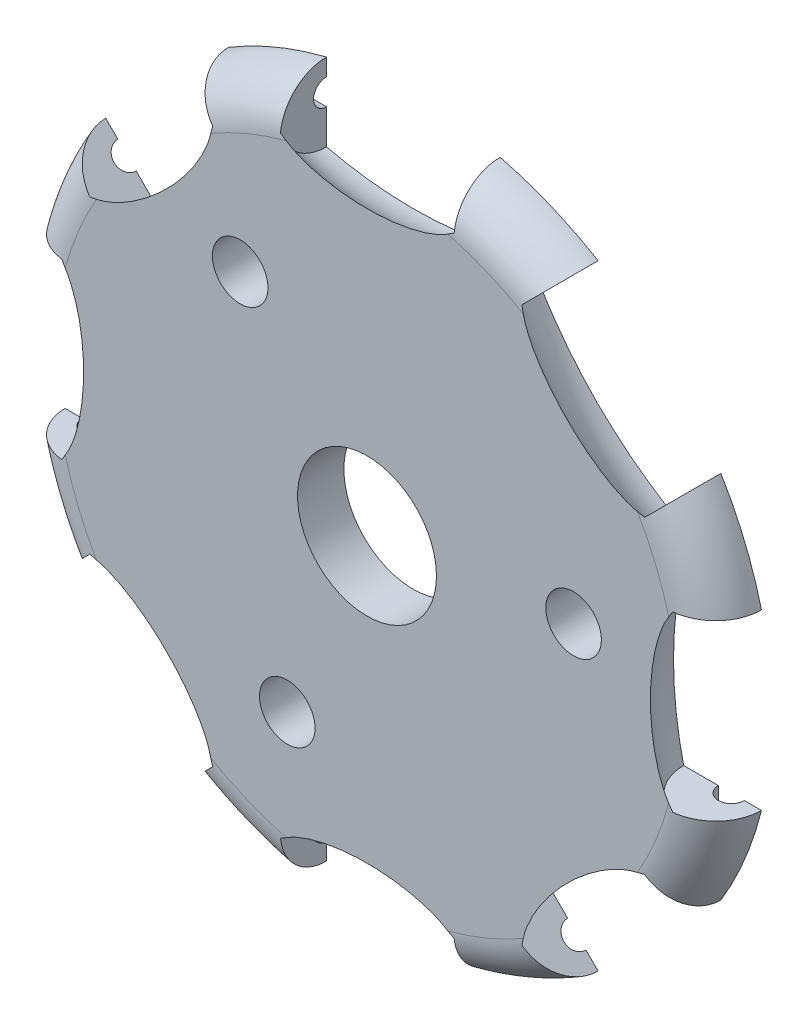
from build123d import *

# Parameters (mm, degrees)
SKETCH1_R           = 24.60625
BOSS_EXTRUDE1_DEPTH = 3.175
FILLET1_R           = 3.18516
SKETCH2_R           = 1.905
SKETCH2_R_2         = 4.7625
CUT_EXTRUDE1_DEPTH  = 35.943012295
SKETCH6_R           = 0.889
CUT_EXTRUDE2_DEPTH  = 7.9375
CIRPATTERN1_COUNT   = 8


with BuildPart() as part:
    # Sketch1 → Boss-Extrude1 (new body)
    with BuildSketch(Plane.XY):
        Circle(SKETCH1_R)
    extrude(amount=BOSS_EXTRUDE1_DEPTH)

    # Fillet1
    # the kernel refuses this fillet: 3.18516 mm, written as the material it takes off along each edge
    with BuildSketch(Plane(origin=(0, 0, 3.175), x_dir=(1, 0, 0), z_dir=(0, -1, 0))) as fillet1_piece_1:
        with BuildLine():
            CenterArc((24.60625 - FILLET1_R, -FILLET1_R), FILLET1_R, 0, 90)
            Line((24.60625 - FILLET1_R, 0), (24.60625, 0))
            Line((24.60625, 0), (24.60625, -FILLET1_R))
        make_face()
    revolve(axis=Axis((0, 0, 3.175), (0, 0, 1)), mode=Mode.SUBTRACT)

    # Sketch2 → Cut-Extrude1 (cut, through all)
    with BuildSketch(Plane.XY.offset(3.175)):
        with Locations((-5.46758954, -13.199928821)):
            Circle(SKETCH2_R)
        with Locations((-8.697678917, 11.335035849)):
            Circle(SKETCH2_R)
        with Locations((14.165268457, 1.864892971)):
            Circle(SKETCH2_R)
        Circle(SKETCH2_R_2)
    extrude(amount=-CUT_EXTRUDE1_DEPTH, mode=Mode.SUBTRACT)

    # Sketch5 → Cut-Revolve1 (revolve, cut)
    with BuildSketch(Plane.XY):
        with BuildLine():
            Line((-5.953125, 21.81225), (5.953125, 21.81225))
            Line((5.953125, 21.81225), (5.953125, 25.084263269))
            ThreePointArc((5.953125, 25.084263269), (0, 25.781), (-5.953125, 25.084263269))
            Line((-5.953125, 25.084263269), (-5.953125, 21.81225))
        make_face()
    cut_revolve1 = revolve(axis=Axis((-5.953125, 21.81225, 0), (-1, 0, 0)), mode=Mode.SUBTRACT)

    # Sketch6 → Cut-Extrude2 (cut, symmetric)
    with BuildSketch(Plane(origin=(0, 0, 0), x_dir=(0, 0, -1), z_dir=(1, 0, 0))):
        with Locations((0, 21.81225)):
            Circle(SKETCH6_R)
    cut_extrude2 = extrude(amount=CUT_EXTRUDE2_DEPTH, both=True, mode=Mode.SUBTRACT)

    # CirPattern1: Cut-Revolve1, Cut-Extrude2 ×8 about axis
    cirpattern1_axis = Axis((0, 0, 0), (0, 0, 1))
    add([cut_revolve1.rotate(cirpattern1_axis, i * 360 / CIRPATTERN1_COUNT) for i in range(1, CIRPATTERN1_COUNT)], mode=Mode.SUBTRACT)
    add([cut_extrude2.rotate(cirpattern1_axis, i * 360 / CIRPATTERN1_COUNT) for i in range(1, CIRPATTERN1_COUNT)], mode=Mode.SUBTRACT)


solid = part.part
